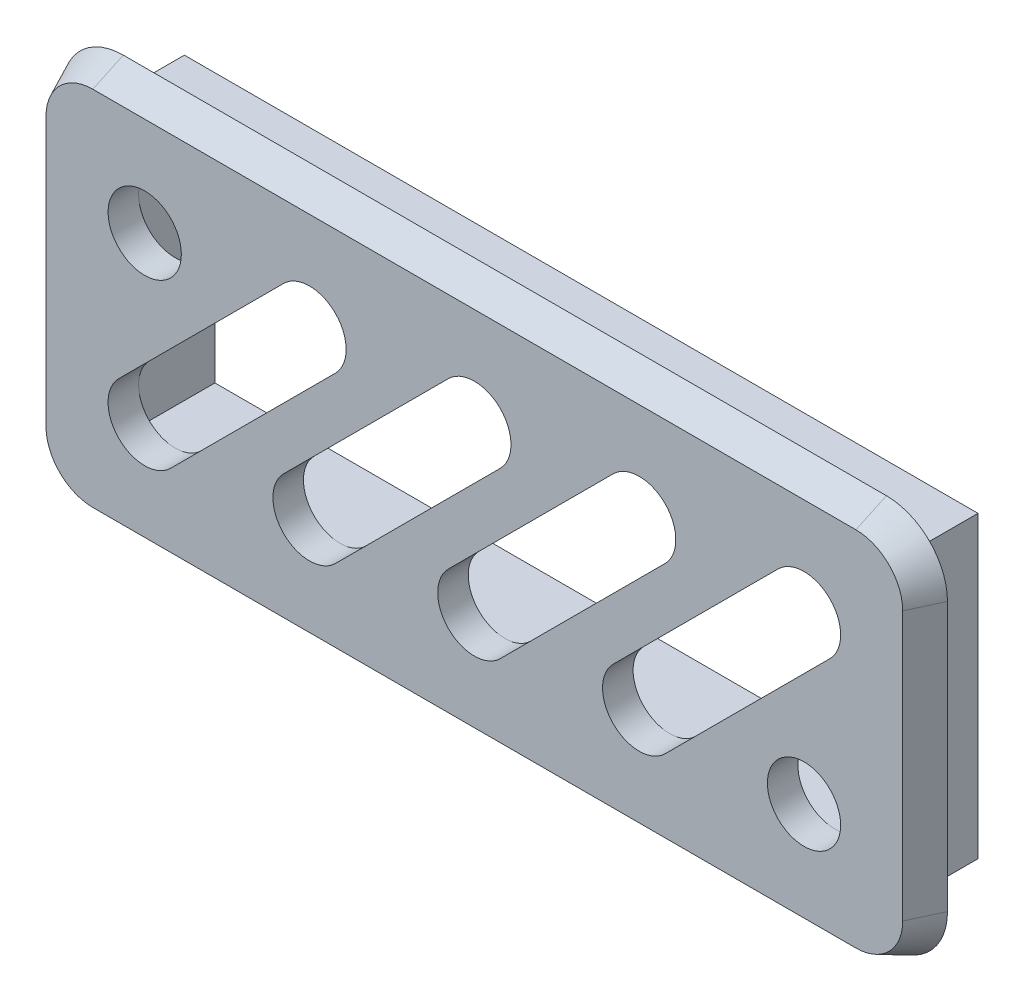
from build123d import *

# Parameters (mm, degrees)
SKETCH_1_W          = 26
SKETCH_1_H          = 9.8
SKETCH_1_W_2        = 24
SKETCH_1_H_2        = 7.8
EXTRUDE_1_DEPTH     = 2.5
EXTRUDE_2_DEPTH     = 1
EXTRUDE_2_TAPER     = 25
CUT_EXTRUDE_1_REACH = 40.157
SKETCH_3_R          = 1.2


with BuildPart() as part:
    # 草图1 → 凸台-拉伸1 (new body)
    with BuildSketch(Plane.XY):
        with Locations((20.66383505, -8.200793938)):
            Rectangle(SKETCH_1_W, SKETCH_1_H)
        with Locations((20.66383505, -8.200793938)):
            Rectangle(SKETCH_1_W_2, SKETCH_1_H_2, mode=Mode.SUBTRACT)
    extrude(amount=-EXTRUDE_1_DEPTH)

    # 草图2 → 凸台-拉伸2 (add)
    with BuildSketch(Plane.XY):
        with BuildLine():
            Line((35.16383505, -12.600793938), (35.16383505, -3.800793938))
            ThreePointArc((35.16383505, -3.800793938), (34.578048612, -2.386580376), (33.16383505, -1.800793938))
            Line((33.16383505, -1.800793938), (8.16383505, -1.800793938))
            ThreePointArc((8.16383505, -1.800793938), (6.749621488, -2.386580376), (6.16383505, -3.800793938))
            Line((6.16383505, -3.800793938), (6.16383505, -12.600793938))
            ThreePointArc((6.16383505, -12.600793938), (6.749621488, -14.015007501), (8.16383505, -14.600793938))
            Line((8.16383505, -14.600793938), (33.16383505, -14.600793938))
            ThreePointArc((33.16383505, -14.600793938), (34.578048612, -14.015007501), (35.16383505, -12.600793938))
        make_face()
    extrude(amount=EXTRUDE_2_DEPTH, taper=EXTRUDE_2_TAPER)

    # 草图3 → 切除-拉伸1 (cut, up to next)
    with BuildSketch(Plane(origin=(0, 0, 0), x_dir=(-1, 0, 0), z_dir=(0, 0, -1)), mode=Mode.PRIVATE) as cut_extrude_1_sk1:
        with Locations((-31.46383505, -10.900793938)):
            Circle(SKETCH_3_R)
    cut_extrude_1_tool1 = extrude(cut_extrude_1_sk1.sketch, amount=-CUT_EXTRUDE_1_REACH, mode=Mode.PRIVATE) & part.part
    # 草图3 → 切除-拉伸1 (cut, up to next)
    with BuildSketch(Plane(origin=(0, 0, 0), x_dir=(-1, 0, 0), z_dir=(0, 0, -1)), mode=Mode.PRIVATE) as cut_extrude_1_sk2:
        with Locations((-9.86383505, -5.500793938)):
            Circle(SKETCH_3_R)
    cut_extrude_1_tool2 = extrude(cut_extrude_1_sk2.sketch, amount=-CUT_EXTRUDE_1_REACH, mode=Mode.PRIVATE) & part.part
    # 草图3 → 切除-拉伸1 (cut, up to next)
    with BuildSketch(Plane(origin=(0, 0, 0), x_dir=(-1, 0, 0), z_dir=(0, 0, -1)), mode=Mode.PRIVATE) as cut_extrude_1_sk3:
        with BuildLine():
            Line((-30.615306913, -4.652265801), (-25.215306913, -10.052265801))
            ThreePointArc((-25.215306913, -10.052265801), (-25.215306913, -11.749322076), (-26.912363188, -11.749322076))
            Line((-26.912363188, -11.749322076), (-32.312363188, -6.349322076))
            ThreePointArc((-32.312363188, -6.349322076), (-32.312363188, -4.652265801), (-30.615306913, -4.652265801))
        make_face()
    cut_extrude_1_tool3 = extrude(cut_extrude_1_sk3.sketch, amount=-CUT_EXTRUDE_1_REACH, mode=Mode.PRIVATE) & part.part
    # 草图3 → 切除-拉伸1 (cut, up to next)
    with BuildSketch(Plane(origin=(0, 0, 0), x_dir=(-1, 0, 0), z_dir=(0, 0, -1)), mode=Mode.PRIVATE) as cut_extrude_1_sk4:
        with BuildLine():
            Line((-25.215306913, -4.652265801), (-19.815306913, -10.052265801))
            ThreePointArc((-19.815306913, -10.052265801), (-19.815306913, -11.749322076), (-21.512363188, -11.749322076))
            Line((-21.512363188, -11.749322076), (-26.912363188, -6.349322076))
            ThreePointArc((-26.912363188, -6.349322076), (-26.912363188, -4.652265801), (-25.215306913, -4.652265801))
        make_face()
    cut_extrude_1_tool4 = extrude(cut_extrude_1_sk4.sketch, amount=-CUT_EXTRUDE_1_REACH, mode=Mode.PRIVATE) & part.part
    # 草图3 → 切除-拉伸1 (cut, up to next)
    with BuildSketch(Plane(origin=(0, 0, 0), x_dir=(-1, 0, 0), z_dir=(0, 0, -1)), mode=Mode.PRIVATE) as cut_extrude_1_sk5:
        with BuildLine():
            Line((-19.815306913, -4.652265801), (-14.415306913, -10.052265801))
            ThreePointArc((-14.415306913, -10.052265801), (-14.415306913, -11.749322076), (-16.112363188, -11.749322076))
            Line((-16.112363188, -11.749322076), (-21.512363188, -6.349322076))
            ThreePointArc((-21.512363188, -6.349322076), (-21.512363188, -4.652265801), (-19.815306913, -4.652265801))
        make_face()
    cut_extrude_1_tool5 = extrude(cut_extrude_1_sk5.sketch, amount=-CUT_EXTRUDE_1_REACH, mode=Mode.PRIVATE) & part.part
    # 草图3 → 切除-拉伸1 (cut, up to next)
    with BuildSketch(Plane(origin=(0, 0, 0), x_dir=(-1, 0, 0), z_dir=(0, 0, -1)), mode=Mode.PRIVATE) as cut_extrude_1_sk6:
        with BuildLine():
            Line((-14.415306913, -4.652265801), (-9.015306913, -10.052265801))
            ThreePointArc((-9.015306913, -10.052265801), (-9.015306913, -11.749322076), (-10.712363188, -11.749322076))
            Line((-10.712363188, -11.749322076), (-16.112363188, -6.349322076))
            ThreePointArc((-16.112363188, -6.349322076), (-16.112363188, -4.652265801), (-14.415306913, -4.652265801))
        make_face()
    cut_extrude_1_tool6 = extrude(cut_extrude_1_sk6.sketch, amount=-CUT_EXTRUDE_1_REACH, mode=Mode.PRIVATE) & part.part
    add(cut_extrude_1_tool1.solids().sort_by_distance((31.463835, -10.900794, 0))[0], mode=Mode.SUBTRACT)
    add(cut_extrude_1_tool2.solids().sort_by_distance((9.863835, -5.500794, 0))[0], mode=Mode.SUBTRACT)
    add(cut_extrude_1_tool3.solids().sort_by_distance((28.763835, -8.200794, 0))[0], mode=Mode.SUBTRACT)
    add(cut_extrude_1_tool4.solids().sort_by_distance((23.363835, -8.200794, 0))[0], mode=Mode.SUBTRACT)
    add(cut_extrude_1_tool5.solids().sort_by_distance((17.963835, -8.200794, 0))[0], mode=Mode.SUBTRACT)
    add(cut_extrude_1_tool6.solids().sort_by_distance((12.563835, -8.200794, 0))[0], mode=Mode.SUBTRACT)


solid = part.part
